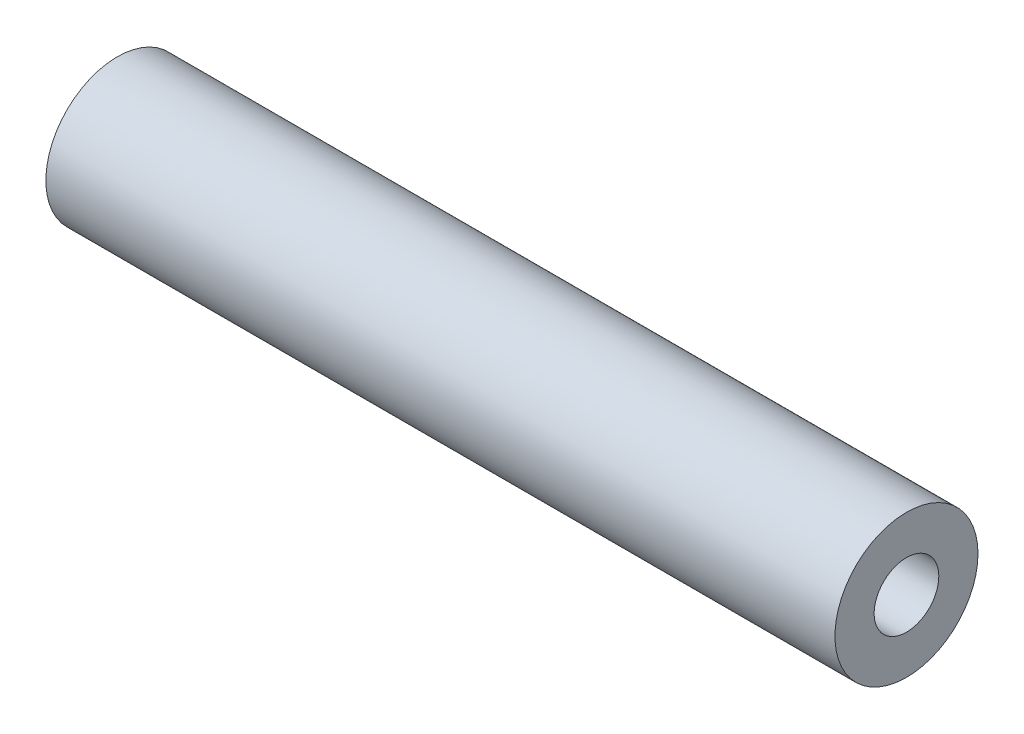
from build123d import *

# Parameters (mm, degrees)
SKETCH1_R           = 4.7625
SKETCH1_R_2         = 2.15265
BOSS_EXTRUDE1_DEPTH = 52.5399


with BuildPart() as part:
    # Sketch1 → Boss-Extrude1 (new body)
    with BuildSketch(Plane(origin=(0, 0, 0), x_dir=(0, 0, -1), z_dir=(1, 0, 0))):
        Circle(SKETCH1_R)
        Circle(SKETCH1_R_2, mode=Mode.SUBTRACT)
    extrude(amount=BOSS_EXTRUDE1_DEPTH)


solid = part.part
